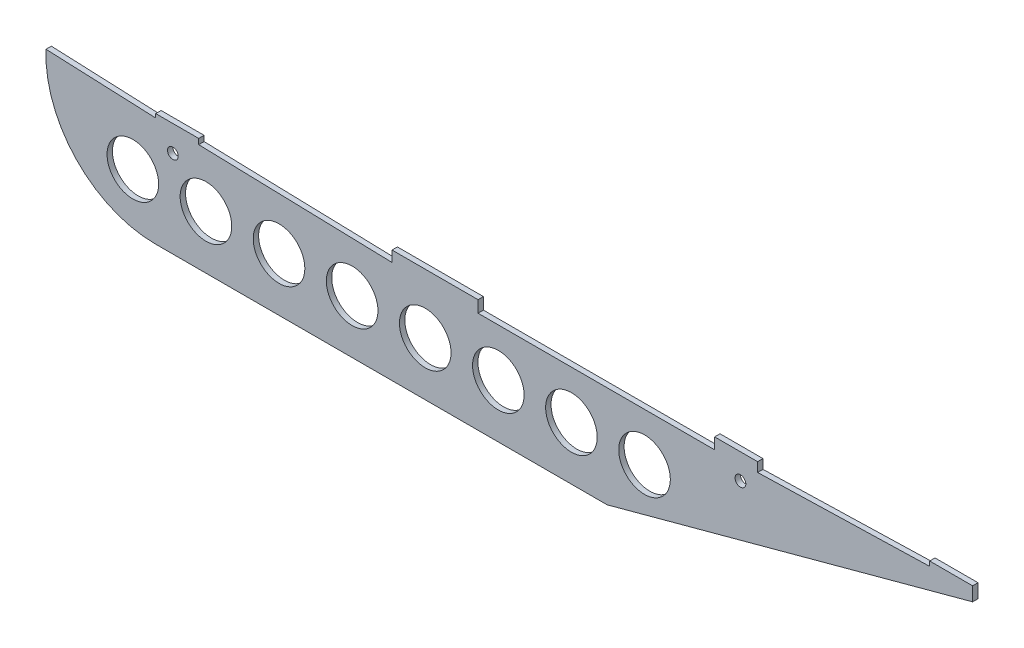
from build123d import *

# Parameters (mm, degrees)
BOSS_EXTRUDE1_DEPTH      = 1.5875
BOSS_EXTRUDE1_DEPTH_BACK = 1.5875
CUT_EXTRUDE1_DEPTH       = 552.50665189
CUT_EXTRUDE1_DEPTH_BACK  = 552.50665189
SKETCH2_R                = 3.175
CUT_EXTRUDE2_DEPTH       = 2.54
CUT_EXTRUDE2_DEPTH_BACK  = 2.54
SKETCH3_R                = 15.24


with BuildPart() as part:
    # Sketch1 → Boss-Extrude1 (new, two sides: drawn at the far end of the back side and taken through both)
    with BuildSketch(Plane.XY.offset(-BOSS_EXTRUDE1_DEPTH_BACK)):
        with BuildLine():
            Line((331.479240226, -67.327812174), (547.379240226, -9.015530032))
            Line((547.379240226, -9.015530032), (547.379240226, -0.80358759))
            Line((547.379240226, -0.80358759), (521.979240226, -0.80358759))
            Line((521.979240226, -0.80358759), (521.979240226, -3.550327588))
            Line((521.979240226, -3.550327588), (420.379240226, -6.318039604))
            Line((420.379240226, -6.318039604), (420.379240226, -0.80358759))
            Line((420.379240226, -0.80358759), (394.979240226, -0.80358759))
            Line((394.979240226, -0.80358759), (394.979240226, -7.4329025))
            Line((394.979240226, -7.4329025), (255.21408059, -7.4329025))
            Line((255.21408059, -7.4329025), (255.21408059, -0.503629592))
            Line((255.21408059, -0.503629592), (204.41408059, -0.503629592))
            Line((204.41408059, -0.503629592), (204.41408059, -6.875812174))
            Line((204.41408059, -6.875812174), (90.223191735, -3.707270632))
            Line((90.223191735, -3.707270632), (90.223191735, -0.503629592))
            Line((90.223191735, -0.503629592), (64.823191735, -0.503629592))
            Line((64.823191735, -0.503629592), (64.823191735, -2.772070572))
            Line((64.823191735, -2.772070572), (0, 0))
            ThreePointArc((0, 0), (17.887759649, -47.42996384), (64.510168925, -67.327812174))
            Line((64.510168925, -67.327812174), (331.479240226, -67.327812174))
        make_face()
    extrude(amount=BOSS_EXTRUDE1_DEPTH + BOSS_EXTRUDE1_DEPTH_BACK)

    # Sketch2 → Cut-Extrude1 (cut, two sides: drawn at the far end of the back side and taken through both)
    with BuildSketch(Plane.XY.offset(-CUT_EXTRUDE1_DEPTH_BACK)):
        with Locations((410.219240226, -15.743629592)):
            Circle(SKETCH2_R)
        with Locations((74.939240226, -15.743629592)):
            Circle(SKETCH2_R)
    extrude(amount=CUT_EXTRUDE1_DEPTH + CUT_EXTRUDE1_DEPTH_BACK, mode=Mode.SUBTRACT)

    # Sketch3 → Cut-Extrude2 (cut, two sides: drawn at the far end of the back side and taken through both)
    with BuildSketch(Plane.XY.offset(-CUT_EXTRUDE2_DEPTH_BACK)):
        with Locations((51.302840924, -35.710884581)):
            Circle(SKETCH3_R)
        with Locations((94.482840924, -35.710884581)):
            Circle(SKETCH3_R)
        with Locations((137.662840924, -35.710884581)):
            Circle(SKETCH3_R)
        with Locations((180.842840924, -35.710884581)):
            Circle(SKETCH3_R)
        with Locations((224.022840924, -35.710884581)):
            Circle(SKETCH3_R)
        with Locations((267.202840924, -35.710884581)):
            Circle(SKETCH3_R)
        with Locations((310.382840924, -35.710884581)):
            Circle(SKETCH3_R)
        with Locations((353.562840924, -35.710884581)):
            Circle(SKETCH3_R)
    extrude(amount=CUT_EXTRUDE2_DEPTH + CUT_EXTRUDE2_DEPTH_BACK, mode=Mode.SUBTRACT)


solid = part.part
